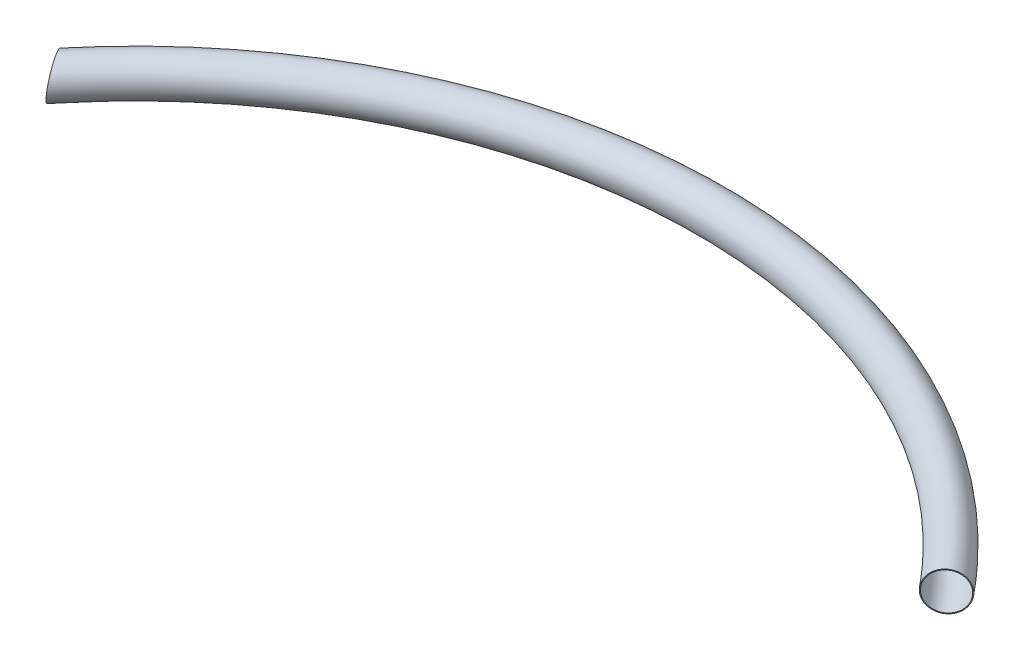
from build123d import *

# Parameters (mm, degrees)
TUBE_OUTLINE_R   = 84.1375
TUBE_OUTLINE_R_2 = 80.7339
TUBE_ANGLE       = 125.66203


# Read off the part's stored shape, not the designer's step: tube
with BuildPart() as part:
    # tube outline → tube (revolve)
    with BuildSketch(Plane(origin=(0, 0, 1141.911607404), x_dir=(0.8896636769492224, 0, -0.4566164056592685), z_dir=(0.4566164056592685, 0, 0.8896636769492224))):
        with Locations((2500.811607404, 0)):
            Circle(TUBE_OUTLINE_R)
        with Locations((2500.811607404, 0)):
            Circle(TUBE_OUTLINE_R_2, mode=Mode.SUBTRACT)
    revolve(axis=Axis((0, 0, 1141.911607404), (0, 1, 0)), revolution_arc=TUBE_ANGLE)

    # right_trim
    split(bisect_by=Plane(origin=(559.473821641, 0, 684.883731267), x_dir=(0, -1, 0), z_dir=(-0.632637748, 0, -0.774447855)), keep=Keep.TOP)

    # pipe4-trim
    split(bisect_by=Plane(origin=(-1204.136873732, 148.172068381, 733.134555259), x_dir=(0.122131336, 0.992513948, 0), z_dir=(0.849462239, -0.104528463, -0.517192135)), keep=Keep.TOP)


solid = part.part
